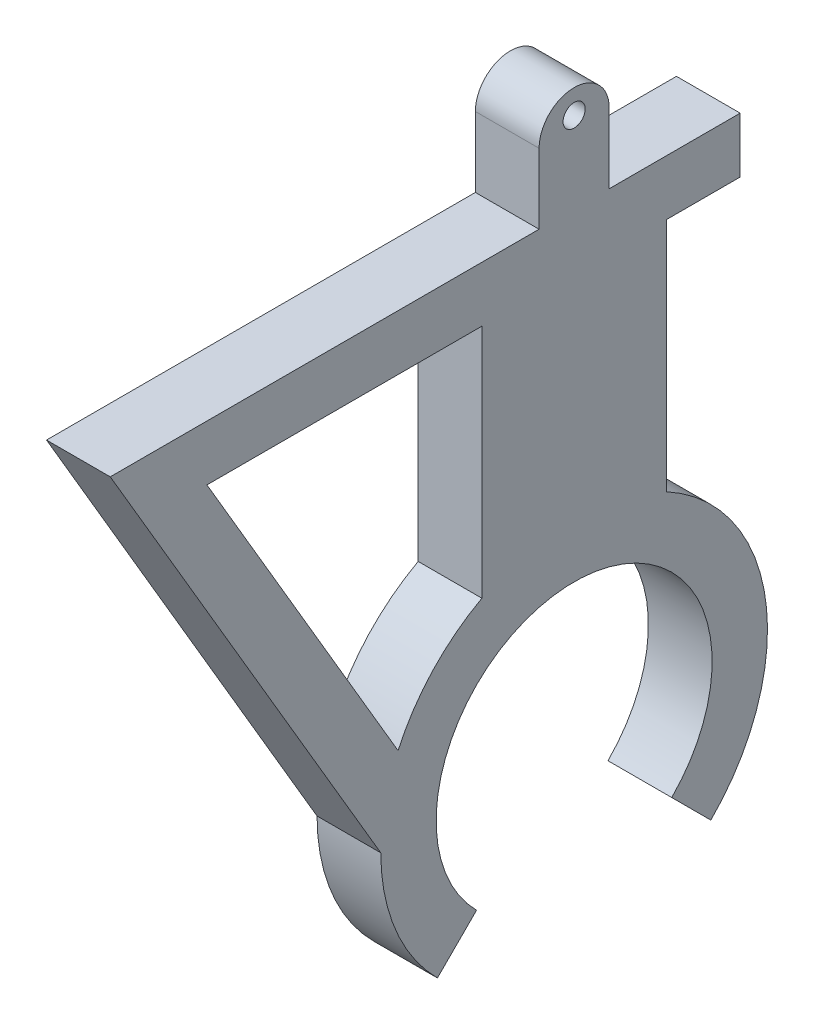
from build123d import *

# Parameters (mm, degrees)
SKETCH1_R           = 0.3
BOSS_EXTRUDE1_DEPTH = 1.7272


with BuildPart() as part:
    # Sketch1 → Boss-Extrude1 (new body)
    with BuildSketch(Plane(origin=(0, 0, 0), x_dir=(0, 0, -1), z_dir=(1, 0, 0))):
        with BuildLine():
            Line((-3.705239533, -3.705239533), (-2.644579362, -2.644579362))
            ThreePointArc((-2.644579362, -2.644579362), (0, 3.74), (2.644579362, -2.644579362))
            Line((2.644579362, -2.644579362), (3.705239533, -3.705239533))
            ThreePointArc((3.705239533, -3.705239533), (5.185747801, 0.752076956), (2.5, 4.605171007))
            Line((2.5, 4.605171007), (2.5, 10.990683939))
            Line((2.5, 10.990683939), (4.5, 10.990683939))
            Line((4.5, 10.990683939), (4.5, 12.490683939))
            Line((4.5, 12.490683939), (0.95, 12.490683939))
            Line((0.95, 12.490683939), (0.95, 14.390683939))
            ThreePointArc((0.95, 14.390683939), (0, 15.340683939), (-0.95, 14.390683939))
            Line((-0.95, 14.390683939), (-0.95, 12.490683939))
            Line((-0.95, 12.490683939), (-12.571622028, 12.490683939))
            Line((-12.571622028, 12.490683939), (-5.24, 0))
            ThreePointArc((-5.24, 0), (-4.84112875, -2.005261186), (-3.705239533, -3.705239533))
        make_face()
        with BuildLine():
            ThreePointArc((-2.5, 4.605171007), (-3.835037239, 3.570726729), (-4.771676297, 2.165341847))
            Line((-4.771676297, 2.165341847), (-9.951862811, 10.990683939))
            Line((-9.951862811, 10.990683939), (-2.5, 10.990683939))
            Line((-2.5, 10.990683939), (-2.5, 4.605171007))
        make_face(mode=Mode.SUBTRACT)
        with Locations((0, 14.690683939)):
            Circle(SKETCH1_R, mode=Mode.SUBTRACT)
    extrude(amount=BOSS_EXTRUDE1_DEPTH)


solid = part.part
